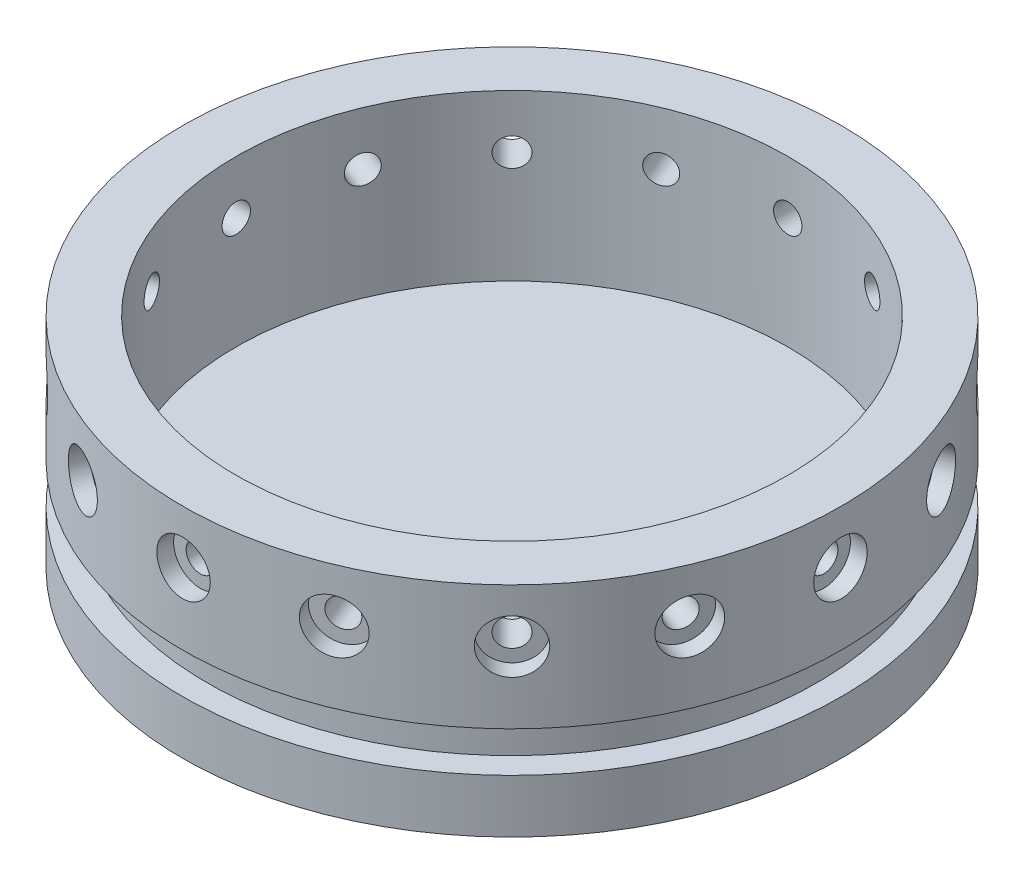
from build123d import *

# Parameters (mm, degrees)
CBORE_FOR_1_4_SOCKET_HEAD_CAP_SCREW1_D           = 5.0546
CBORE_FOR_1_4_SOCKET_HEAD_CAP_SCREW1_CBORE_D     = 9.525
CBORE_FOR_1_4_SOCKET_HEAD_CAP_SCREW1_CBORE_DEPTH = 3.175
CIRPATTERN1_COUNT                                = 16


with BuildPart() as part:
    # Sketch1 → Revolve1 (revolve)
    with BuildSketch(Plane.XY):
        Polygon((0, 9.525), (0, 0), (58.7375, 0), (58.7375, 9.525), (9.525, 9.525), (9.525, 38.9382), (0, 38.9382), (0, 32.5882), (0, 26.2382), (0, 16.7132), (4.318, 16.7132), (4.318, 9.525), align=None)
    revolve(axis=Axis((58.7375, 0, 0), (0, 1, 0)))

    # CBORE for 1/4 Socket Head Cap Screw1 (through all)
    with Locations(Plane(origin=(0, 0, -58.7375), x_dir=(-1, 0, 0), z_dir=(0, 0, -1))):
        with Locations((-58.7375, 29.4132)):
            cbore_for_1_4_socket_head_cap_screw1 = CounterBoreHole(CBORE_FOR_1_4_SOCKET_HEAD_CAP_SCREW1_D / 2, CBORE_FOR_1_4_SOCKET_HEAD_CAP_SCREW1_CBORE_D / 2, CBORE_FOR_1_4_SOCKET_HEAD_CAP_SCREW1_CBORE_DEPTH)

    # CirPattern1: CBORE for 1/4 Socket Head Cap Screw1 ×16 about axis
    cirpattern1_axis = Axis((58.7375, 0, 0), (0, 1, 0))
    for i in range(1, CIRPATTERN1_COUNT):
        add(cbore_for_1_4_socket_head_cap_screw1.rotate(cirpattern1_axis, i * 360 / CIRPATTERN1_COUNT), mode=Mode.SUBTRACT)


solid = part.part
